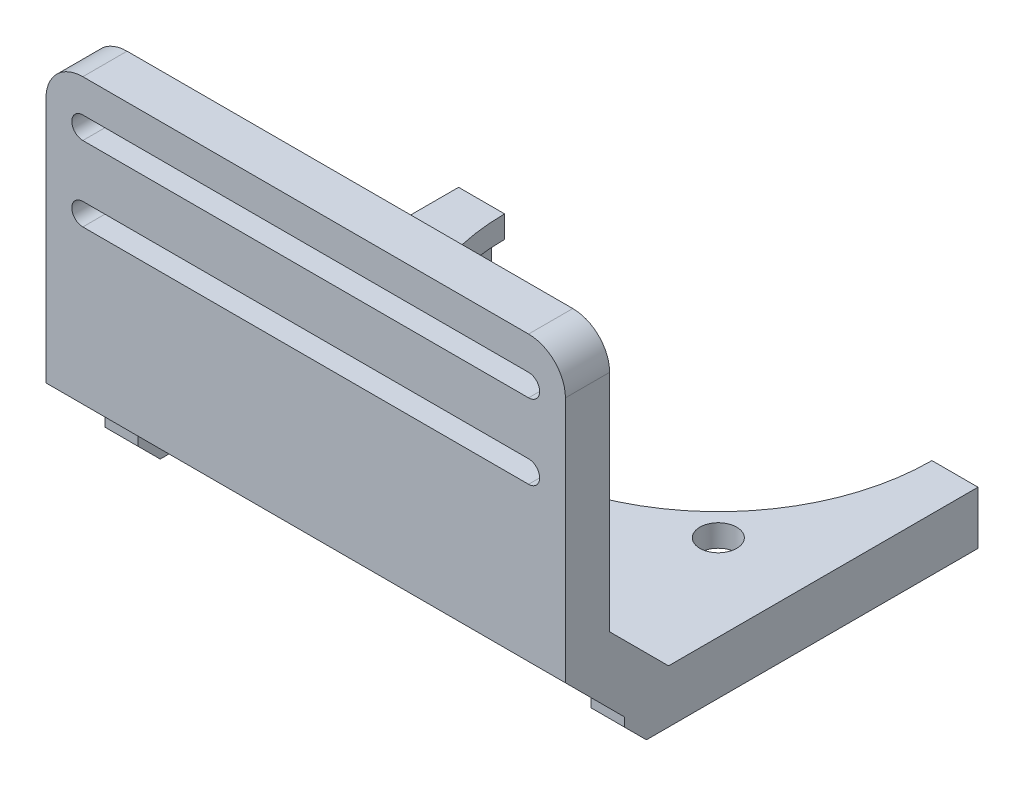
from build123d import *

# Parameters (mm, degrees)
SKETCH1_W           = 70.5
SKETCH1_H           = 46.5
BOSS_EXTRUDE1_DEPTH = 6
SKETCH2_W           = 70.5
SKETCH2_H           = 3
BOSS_EXTRUDE2_DEPTH = 50
CUT_EXTRUDE1_REACH  = 77.065
SKETCH3_R           = 29
SKETCH4_W           = 8
SKETCH4_H           = 8
BOSS_EXTRUDE3_DEPTH = 70.5
CHAMFER1_SIZE       = 8
SKETCH5_R           = 2.5
CUT_EXTRUDE2_DEPTH  = 20
SKETCH6_W           = 4.5
SKETCH6_H           = 48
BOSS_EXTRUDE4_DEPTH = 4.2
CHAMFER2_SIZE       = 3
CUT_EXTRUDE3_REACH  = 73.638
CUT_EXTRUDE4_START  = -3
CUT_EXTRUDE4_DEPTH  = 3
FILLET1_R           = 5


with BuildPart() as part:
    # Sketch1 → Boss-Extrude1 (new body)
    with BuildSketch(Plane.XY):
        Rectangle(SKETCH1_W, SKETCH1_H)
    extrude(amount=BOSS_EXTRUDE1_DEPTH)

    # Sketch2 → Boss-Extrude2 (add)
    with BuildSketch(Plane(origin=(0, 0, 0), x_dir=(-1, 0, 0), z_dir=(0, 0, -1))):
        with Locations((0, -21.75)):
            Rectangle(SKETCH2_W, SKETCH2_H)
    extrude(amount=BOSS_EXTRUDE2_DEPTH)

    # Sketch3 → Cut-Extrude1 (cut, up to next)
    with BuildSketch(Plane(origin=(0, -20.25, 0), x_dir=(1, 0, 0), z_dir=(0, 1, 0)), mode=Mode.PRIVATE) as cut_extrude1_sk1:
        with Locations((0, 50)):
            Circle(SKETCH3_R)
    cut_extrude1_tool1 = extrude(cut_extrude1_sk1.sketch, amount=-CUT_EXTRUDE1_REACH, mode=Mode.PRIVATE) & part.part
    add(cut_extrude1_tool1.solids().sort_by_distance((0, -20.25, -50))[0], mode=Mode.SUBTRACT)

    # Sketch4 → Boss-Extrude3 (add)
    with BuildSketch(Plane(origin=(35.25, 0, 0), x_dir=(0, 0, -1), z_dir=(1, 0, 0))):
        with Locations((4, -16.25)):
            Rectangle(SKETCH4_W, SKETCH4_H)
    extrude(amount=-BOSS_EXTRUDE3_DEPTH)

    # Chamfer1
    chamfer1_edges = [part.edges().sort_by_distance(p)[0] for p in [
        (0, -12.25, -8),
        (0, -23.25, 6),
    ]]
    chamfer(chamfer1_edges, length=CHAMFER1_SIZE - 0.0001)  # a hair under: the kernel refuses the full size

    # Sketch5 → Cut-Extrude2 (cut)
    with BuildSketch(Plane(origin=(0, -20.25, 0), x_dir=(1, 0, 0), z_dir=(0, 1, 0))):
        with Locations(Location((-23.57, 26.43, 0), (0, 0, 270))):
            Circle(SKETCH5_R)
        with Locations(Location((23.57, 26.43, 0), (0, 0, 270))):
            Circle(SKETCH5_R)
    extrude(amount=-CUT_EXTRUDE2_DEPTH, mode=Mode.SUBTRACT)

    # Sketch6 → Boss-Extrude4 (add)
    with BuildSketch(Plane.XZ.offset(23.25)):
        with Locations((-33, -26)):
            Rectangle(SKETCH6_W, SKETCH6_H)
        with Locations((33, -26)):
            Rectangle(SKETCH6_W, SKETCH6_H)
    extrude(amount=BOSS_EXTRUDE4_DEPTH)

    # Chamfer2
    chamfer2_edges = [part.edges().sort_by_distance(p)[0] for p in [
        (-33, -27.45, -2),
        (33, -27.45, -2),
    ]]
    chamfer(chamfer2_edges, length=CHAMFER2_SIZE)

    # Sketch7 → Cut-Extrude3 (cut, up to next)
    with BuildSketch(Plane.XY.offset(6), mode=Mode.PRIVATE) as cut_extrude3_sk1:
        with BuildLine():
            ThreePointArc((-28.75, 17.25), (-29.189339828, 18.310660172), (-30.25, 18.75))
            Line((-30.25, 18.75), (-30.25, 15.75))
            ThreePointArc((-30.25, 15.75), (-29.189339828, 16.189339828), (-28.75, 17.25))
        make_face()
    cut_extrude3_tool1 = extrude(cut_extrude3_sk1.sketch, amount=-CUT_EXTRUDE3_REACH, mode=Mode.PRIVATE) & part.part
    # Sketch7 → Cut-Extrude3 (cut, up to next)
    with BuildSketch(Plane.XY.offset(6), mode=Mode.PRIVATE) as cut_extrude3_sk2:
        with BuildLine():
            Line((-30.25, 15.75), (-30.25, 18.75))
            ThreePointArc((-30.25, 18.75), (-31.75, 17.25), (-30.25, 15.75))
        make_face()
    cut_extrude3_tool2 = extrude(cut_extrude3_sk2.sketch, amount=-CUT_EXTRUDE3_REACH, mode=Mode.PRIVATE) & part.part
    # Sketch7 → Cut-Extrude3 (cut, up to next)
    with BuildSketch(Plane.XY.offset(6), mode=Mode.PRIVATE) as cut_extrude3_sk3:
        with BuildLine():
            ThreePointArc((-28.75, 17.25), (-29.189339828, 18.310660172), (-30.25, 18.75))
            Line((-30.25, 18.75), (-30.25, 15.75))
            ThreePointArc((-30.25, 15.75), (-29.189339828, 16.189339828), (-28.75, 17.25))
        make_face()
    cut_extrude3_tool3 = extrude(cut_extrude3_sk3.sketch, amount=-CUT_EXTRUDE3_REACH, mode=Mode.PRIVATE) & part.part
    # Sketch7 → Cut-Extrude3 (cut, up to next)
    with BuildSketch(Plane.XY.offset(6), mode=Mode.PRIVATE) as cut_extrude3_sk4:
        with BuildLine():
            Line((-30.25, 15.75), (-30.25, 18.75))
            ThreePointArc((-30.25, 18.75), (-31.75, 17.25), (-30.25, 15.75))
        make_face()
    cut_extrude3_tool4 = extrude(cut_extrude3_sk4.sketch, amount=-CUT_EXTRUDE3_REACH, mode=Mode.PRIVATE) & part.part
    # Sketch7 → Cut-Extrude3 (cut, up to next)
    with BuildSketch(Plane.XY.offset(6), mode=Mode.PRIVATE) as cut_extrude3_sk5:
        with BuildLine():
            Line((30.25, 18.75), (-30.25, 18.75))
            ThreePointArc((-30.25, 18.75), (-29.189339828, 18.310660172), (-28.75, 17.25))
            ThreePointArc((-28.75, 17.25), (-29.189339828, 16.189339828), (-30.25, 15.75))
            Line((-30.25, 15.75), (30.25, 15.75))
            ThreePointArc((30.25, 15.75), (28.75, 17.25), (30.25, 18.75))
        make_face()
    cut_extrude3_tool5 = extrude(cut_extrude3_sk5.sketch, amount=-CUT_EXTRUDE3_REACH, mode=Mode.PRIVATE) & part.part
    # Sketch7 → Cut-Extrude3 (cut, up to next)
    with BuildSketch(Plane.XY.offset(6), mode=Mode.PRIVATE) as cut_extrude3_sk6:
        with BuildLine():
            ThreePointArc((-28.75, 7.09), (-29.189339828, 8.150660172), (-30.25, 8.59))
            Line((-30.25, 8.59), (-30.25, 5.59))
            ThreePointArc((-30.25, 5.59), (-29.189339828, 6.029339828), (-28.75, 7.09))
        make_face()
    cut_extrude3_tool6 = extrude(cut_extrude3_sk6.sketch, amount=-CUT_EXTRUDE3_REACH, mode=Mode.PRIVATE) & part.part
    # Sketch7 → Cut-Extrude3 (cut, up to next)
    with BuildSketch(Plane.XY.offset(6), mode=Mode.PRIVATE) as cut_extrude3_sk7:
        with BuildLine():
            Line((-30.25, 5.59), (-30.25, 8.59))
            ThreePointArc((-30.25, 8.59), (-31.75, 7.09), (-30.25, 5.59))
        make_face()
    cut_extrude3_tool7 = extrude(cut_extrude3_sk7.sketch, amount=-CUT_EXTRUDE3_REACH, mode=Mode.PRIVATE) & part.part
    # Sketch7 → Cut-Extrude3 (cut, up to next)
    with BuildSketch(Plane.XY.offset(6), mode=Mode.PRIVATE) as cut_extrude3_sk8:
        with BuildLine():
            ThreePointArc((-28.75, 7.09), (-29.189339828, 8.150660172), (-30.25, 8.59))
            Line((-30.25, 8.59), (-30.25, 5.59))
            ThreePointArc((-30.25, 5.59), (-29.189339828, 6.029339828), (-28.75, 7.09))
        make_face()
    cut_extrude3_tool8 = extrude(cut_extrude3_sk8.sketch, amount=-CUT_EXTRUDE3_REACH, mode=Mode.PRIVATE) & part.part
    # Sketch7 → Cut-Extrude3 (cut, up to next)
    with BuildSketch(Plane.XY.offset(6), mode=Mode.PRIVATE) as cut_extrude3_sk9:
        with BuildLine():
            Line((-30.25, 5.59), (-30.25, 8.59))
            ThreePointArc((-30.25, 8.59), (-31.75, 7.09), (-30.25, 5.59))
        make_face()
    cut_extrude3_tool9 = extrude(cut_extrude3_sk9.sketch, amount=-CUT_EXTRUDE3_REACH, mode=Mode.PRIVATE) & part.part
    # Sketch7 → Cut-Extrude3 (cut, up to next)
    with BuildSketch(Plane.XY.offset(6), mode=Mode.PRIVATE) as cut_extrude3_sk10:
        with BuildLine():
            Line((30.25, 8.59), (-30.25, 8.59))
            ThreePointArc((-30.25, 8.59), (-29.189339828, 8.150660172), (-28.75, 7.09))
            ThreePointArc((-28.75, 7.09), (-29.189339828, 6.029339828), (-30.25, 5.59))
            Line((-30.25, 5.59), (30.25, 5.59))
            ThreePointArc((30.25, 5.59), (28.75, 7.09), (30.25, 8.59))
        make_face()
    cut_extrude3_tool10 = extrude(cut_extrude3_sk10.sketch, amount=-CUT_EXTRUDE3_REACH, mode=Mode.PRIVATE) & part.part
    # Sketch7 → Cut-Extrude3 (cut, up to next)
    with BuildSketch(Plane.XY.offset(6), mode=Mode.PRIVATE) as cut_extrude3_sk11:
        with BuildLine():
            ThreePointArc((31.75, 17.25), (31.310660172, 18.310660172), (30.25, 18.75))
            Line((30.25, 18.75), (30.25, 15.75))
            ThreePointArc((30.25, 15.75), (31.310660172, 16.189339828), (31.75, 17.25))
        make_face()
    cut_extrude3_tool11 = extrude(cut_extrude3_sk11.sketch, amount=-CUT_EXTRUDE3_REACH, mode=Mode.PRIVATE) & part.part
    # Sketch7 → Cut-Extrude3 (cut, up to next)
    with BuildSketch(Plane.XY.offset(6), mode=Mode.PRIVATE) as cut_extrude3_sk12:
        with BuildLine():
            Line((30.25, 15.75), (30.25, 18.75))
            ThreePointArc((30.25, 18.75), (28.75, 17.25), (30.25, 15.75))
        make_face()
    cut_extrude3_tool12 = extrude(cut_extrude3_sk12.sketch, amount=-CUT_EXTRUDE3_REACH, mode=Mode.PRIVATE) & part.part
    # Sketch7 → Cut-Extrude3 (cut, up to next)
    with BuildSketch(Plane.XY.offset(6), mode=Mode.PRIVATE) as cut_extrude3_sk13:
        with BuildLine():
            ThreePointArc((31.75, 17.25), (31.310660172, 18.310660172), (30.25, 18.75))
            Line((30.25, 18.75), (30.25, 15.75))
            ThreePointArc((30.25, 15.75), (31.310660172, 16.189339828), (31.75, 17.25))
        make_face()
    cut_extrude3_tool13 = extrude(cut_extrude3_sk13.sketch, amount=-CUT_EXTRUDE3_REACH, mode=Mode.PRIVATE) & part.part
    # Sketch7 → Cut-Extrude3 (cut, up to next)
    with BuildSketch(Plane.XY.offset(6), mode=Mode.PRIVATE) as cut_extrude3_sk14:
        with BuildLine():
            Line((30.25, 15.75), (30.25, 18.75))
            ThreePointArc((30.25, 18.75), (28.75, 17.25), (30.25, 15.75))
        make_face()
    cut_extrude3_tool14 = extrude(cut_extrude3_sk14.sketch, amount=-CUT_EXTRUDE3_REACH, mode=Mode.PRIVATE) & part.part
    # Sketch7 → Cut-Extrude3 (cut, up to next)
    with BuildSketch(Plane.XY.offset(6), mode=Mode.PRIVATE) as cut_extrude3_sk15:
        with BuildLine():
            ThreePointArc((31.75, 7.09), (31.310660172, 8.150660172), (30.25, 8.59))
            Line((30.25, 8.59), (30.25, 5.59))
            ThreePointArc((30.25, 5.59), (31.310660172, 6.029339828), (31.75, 7.09))
        make_face()
    cut_extrude3_tool15 = extrude(cut_extrude3_sk15.sketch, amount=-CUT_EXTRUDE3_REACH, mode=Mode.PRIVATE) & part.part
    # Sketch7 → Cut-Extrude3 (cut, up to next)
    with BuildSketch(Plane.XY.offset(6), mode=Mode.PRIVATE) as cut_extrude3_sk16:
        with BuildLine():
            Line((30.25, 5.59), (30.25, 8.59))
            ThreePointArc((30.25, 8.59), (28.75, 7.09), (30.25, 5.59))
        make_face()
    cut_extrude3_tool16 = extrude(cut_extrude3_sk16.sketch, amount=-CUT_EXTRUDE3_REACH, mode=Mode.PRIVATE) & part.part
    # Sketch7 → Cut-Extrude3 (cut, up to next)
    with BuildSketch(Plane.XY.offset(6), mode=Mode.PRIVATE) as cut_extrude3_sk17:
        with BuildLine():
            ThreePointArc((31.75, 7.09), (31.310660172, 8.150660172), (30.25, 8.59))
            Line((30.25, 8.59), (30.25, 5.59))
            ThreePointArc((30.25, 5.59), (31.310660172, 6.029339828), (31.75, 7.09))
        make_face()
    cut_extrude3_tool17 = extrude(cut_extrude3_sk17.sketch, amount=-CUT_EXTRUDE3_REACH, mode=Mode.PRIVATE) & part.part
    # Sketch7 → Cut-Extrude3 (cut, up to next)
    with BuildSketch(Plane.XY.offset(6), mode=Mode.PRIVATE) as cut_extrude3_sk18:
        with BuildLine():
            Line((30.25, 5.59), (30.25, 8.59))
            ThreePointArc((30.25, 8.59), (28.75, 7.09), (30.25, 5.59))
        make_face()
    cut_extrude3_tool18 = extrude(cut_extrude3_sk18.sketch, amount=-CUT_EXTRUDE3_REACH, mode=Mode.PRIVATE) & part.part
    add(cut_extrude3_tool1.solids().sort_by_distance((-29.61338, 17.25, 6))[0], mode=Mode.SUBTRACT)
    add(cut_extrude3_tool2.solids().sort_by_distance((-30.88662, 17.25, 6))[0], mode=Mode.SUBTRACT)
    add(cut_extrude3_tool3.solids().sort_by_distance((-29.61338, 17.25, 6))[0], mode=Mode.SUBTRACT)
    add(cut_extrude3_tool4.solids().sort_by_distance((-30.88662, 17.25, 6))[0], mode=Mode.SUBTRACT)
    add(cut_extrude3_tool5.solids().sort_by_distance((0, 17.25, 6))[0], mode=Mode.SUBTRACT)
    add(cut_extrude3_tool6.solids().sort_by_distance((-29.61338, 7.09, 6))[0], mode=Mode.SUBTRACT)
    add(cut_extrude3_tool7.solids().sort_by_distance((-30.88662, 7.09, 6))[0], mode=Mode.SUBTRACT)
    add(cut_extrude3_tool8.solids().sort_by_distance((-29.61338, 7.09, 6))[0], mode=Mode.SUBTRACT)
    add(cut_extrude3_tool9.solids().sort_by_distance((-30.88662, 7.09, 6))[0], mode=Mode.SUBTRACT)
    add(cut_extrude3_tool10.solids().sort_by_distance((0, 7.09, 6))[0], mode=Mode.SUBTRACT)
    add(cut_extrude3_tool11.solids().sort_by_distance((30.88662, 17.25, 6))[0], mode=Mode.SUBTRACT)
    add(cut_extrude3_tool12.solids().sort_by_distance((29.61338, 17.25, 6))[0], mode=Mode.SUBTRACT)
    add(cut_extrude3_tool13.solids().sort_by_distance((30.88662, 17.25, 6))[0], mode=Mode.SUBTRACT)
    add(cut_extrude3_tool14.solids().sort_by_distance((29.61338, 17.25, 6))[0], mode=Mode.SUBTRACT)
    add(cut_extrude3_tool15.solids().sort_by_distance((30.88662, 7.09, 6))[0], mode=Mode.SUBTRACT)
    add(cut_extrude3_tool16.solids().sort_by_distance((29.61338, 7.09, 6))[0], mode=Mode.SUBTRACT)
    add(cut_extrude3_tool17.solids().sort_by_distance((30.88662, 7.09, 6))[0], mode=Mode.SUBTRACT)
    add(cut_extrude3_tool18.solids().sort_by_distance((29.61338, 7.09, 6))[0], mode=Mode.SUBTRACT)

    # Sketch8 → Cut-Extrude4 (cut)
    # profile 1 of 2: a face of its own
    with BuildSketch(Plane(origin=(0, 0, 0), x_dir=(-1, 0, 0), z_dir=(0, 0, -1)).offset(CUT_EXTRUDE4_START)):
        with BuildLine():
            ThreePointArc((30.25, 4.34), (33, 7.09), (30.25, 9.84))
            Line((30.25, 9.84), (-30.25, 9.84))
            ThreePointArc((-30.25, 9.84), (-33, 7.09), (-30.25, 4.34))
            Line((-30.25, 4.34), (30.25, 4.34))
        make_face()
        with BuildLine():
            ThreePointArc((-30.25, 5.59), (-31.75, 7.09), (-30.25, 8.59))
            Line((-30.25, 8.59), (30.25, 8.59))
            ThreePointArc((30.25, 8.59), (31.75, 7.09), (30.25, 5.59))
            Line((30.25, 5.59), (-30.25, 5.59))
        make_face(mode=Mode.SUBTRACT)
    # profile 2 of 2: a face of its own
    with BuildSketch(Plane(origin=(0, 0, 0), x_dir=(-1, 0, 0), z_dir=(0, 0, -1)).offset(CUT_EXTRUDE4_START)):
        with BuildLine():
            ThreePointArc((30.25, 14.5), (33, 17.25), (30.25, 20))
            Line((30.25, 20), (-30.25, 20))
            ThreePointArc((-30.25, 20), (-33, 17.25), (-30.25, 14.5))
            Line((-30.25, 14.5), (30.25, 14.5))
        make_face()
        with BuildLine():
            ThreePointArc((-30.25, 15.75), (-31.75, 17.25), (-30.25, 18.75))
            Line((-30.25, 18.75), (30.25, 18.75))
            ThreePointArc((30.25, 18.75), (31.75, 17.25), (30.25, 15.75))
            Line((30.25, 15.75), (-30.25, 15.75))
        make_face(mode=Mode.SUBTRACT)
    extrude(amount=CUT_EXTRUDE4_DEPTH, mode=Mode.SUBTRACT)

    # Fillet1
    fillet1_edges = [part.edges().sort_by_distance(p)[0] for p in [
        (-35.25, 23.25, 3),
        (35.25, 23.25, 3),
    ]]
    fillet(fillet1_edges, radius=FILLET1_R)


solid = part.part
